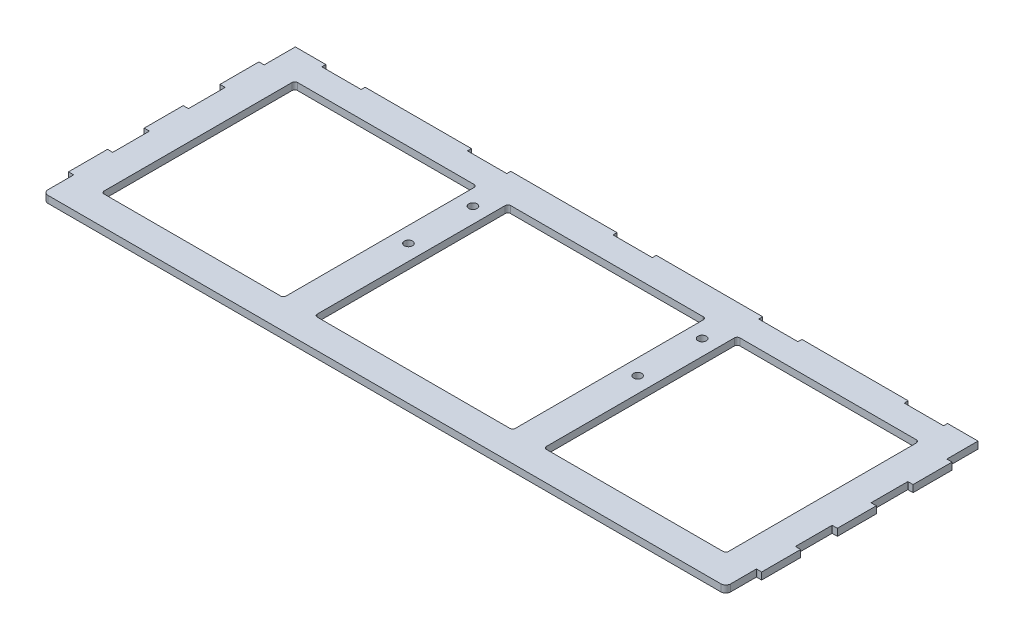
from build123d import *

# Parameters (mm, degrees)
BASE_FLANGE1_DEPTH  = 4.5
CUT_EXTRUDE1_DEPTH  = 235.407023146
SKETCH7_W           = 25.2
SKETCH7_H           = 2.55
CUT_EXTRUDE2_DEPTH  = 10
SKETCH8_W           = 3
SKETCH8_H           = 25
BOSS_EXTRUDE1_DEPTH = 4.5
CUT_EXTRUDE3_START  = -4.55
SKETCH10_W          = 0.35
SKETCH10_H          = 23.55
SKETCH10_H_2        = 20
CUT_EXTRUDE3_DEPTH  = 4.55
SKETCH11_R          = 2.65
CUT_EXTRUDE4_DEPTH  = 238.093473128


# Sheet-metal steps are written as plain solids
with BuildPart() as part:
    # Sketch1 → Base-Flange1 (new body)
    with BuildSketch(Plane(origin=(0, 0, 0), x_dir=(1, 0, 0), z_dir=(0, 1, 0))):
        with BuildLine():
            Line((-219.25, 79.3), (219.25, 79.3))
            Line((219.25, 79.3), (219.25, -79.3))
            ThreePointArc((219.25, -79.3), (218.224873734, -81.774873734), (215.75, -82.8))
            Line((215.75, -82.8), (-215.75, -82.8))
            ThreePointArc((-215.75, -82.8), (-218.224873734, -81.774873734), (-219.25, -79.3))
            Line((-219.25, -79.3), (-219.25, 79.3))
        make_face()
    extrude(amount=-BASE_FLANGE1_DEPTH)

    # Sketch6 → Cut-Extrude1 (cut, through all)
    with BuildSketch(Plane(origin=(0, 0, 0), x_dir=(1, 0, 0), z_dir=(0, 1, 0))):
        with BuildLine():
            Line((-198.45, 60.25), (-85.25, 60.25))
            ThreePointArc((-85.25, 60.25), (-84.012563133, 59.737436867), (-83.5, 58.5))
            Line((-83.5, 58.5), (-83.5, -62))
            ThreePointArc((-83.5, -62), (-84.012563133, -63.237436867), (-85.25, -63.75))
            Line((-85.25, -63.75), (-198.45, -63.75))
            ThreePointArc((-198.45, -63.75), (-199.687436867, -63.237436867), (-200.2, -62))
            Line((-200.2, -62), (-200.2, 58.5))
            ThreePointArc((-200.2, 58.5), (-199.687436867, 59.737436867), (-198.45, 60.25))
        make_face()
        with BuildLine():
            Line((200.2, 58.5), (200.2, -62))
            ThreePointArc((200.2, -62), (199.687436867, -63.237436867), (198.45, -63.75))
            Line((198.45, -63.75), (85.25, -63.75))
            ThreePointArc((85.25, -63.75), (84.012563133, -63.237436867), (83.5, -62))
            Line((83.5, -62), (83.5, 58.5))
            ThreePointArc((83.5, 58.5), (84.012563133, 59.737436867), (85.25, 60.25))
            Line((85.25, 60.25), (198.45, 60.25))
            ThreePointArc((198.45, 60.25), (199.687436867, 59.737436867), (200.2, 58.5))
        make_face()
        with BuildLine():
            Line((63.5, 58.5), (63.5, -62))
            ThreePointArc((63.5, -62), (62.987436867, -63.237436867), (61.75, -63.75))
            Line((61.75, -63.75), (-61.75, -63.75))
            ThreePointArc((-61.75, -63.75), (-62.987436867, -63.237436867), (-63.5, -62))
            Line((-63.5, -62), (-63.5, 58.5))
            ThreePointArc((-63.5, 58.5), (-62.987436867, 59.737436867), (-61.75, 60.25))
            Line((-61.75, 60.25), (61.75, 60.25))
            ThreePointArc((61.75, 60.25), (62.987436867, 59.737436867), (63.5, 58.5))
        make_face()
    extrude(amount=-CUT_EXTRUDE1_DEPTH, mode=Mode.SUBTRACT)

    # Sketch7 → Cut-Extrude2 (cut)
    with BuildSketch(Plane(origin=(0, 0, 0), x_dir=(1, 0, 0), z_dir=(0, 1, 0))):
        with Locations((-186.75, 78.025)):
            Rectangle(SKETCH7_W, SKETCH7_H)
        with Locations((-93.375, 78.025)):
            Rectangle(SKETCH7_W, SKETCH7_H)
        with Locations((0, 78.025)):
            Rectangle(SKETCH7_W, SKETCH7_H)
        with Locations((93.375, 78.025)):
            Rectangle(SKETCH7_W, SKETCH7_H)
        with Locations((186.75, 78.025)):
            Rectangle(SKETCH7_W, SKETCH7_H)
    extrude(amount=-CUT_EXTRUDE2_DEPTH, mode=Mode.SUBTRACT)

    # Sketch8 → Boss-Extrude1 (add)
    with BuildSketch(Plane(origin=(0, 0, 0), x_dir=(1, 0, 0), z_dir=(0, 1, 0))):
        with Locations((220.75, -1.75)):
            Rectangle(SKETCH8_W, SKETCH8_H)
        with Locations((220.75, 46.8)):
            Rectangle(SKETCH8_W, SKETCH8_H)
        with Locations((220.75, -50.3)):
            Rectangle(SKETCH8_W, SKETCH8_H)
    boss_extrude1 = extrude(amount=-BOSS_EXTRUDE1_DEPTH)

    # Mirror1: Boss-Extrude1 across plane
    add(boss_extrude1.mirror(Plane(origin=(0, 0, 0), x_dir=(0, 0, 1), z_dir=(1, 0, 0))))

    # Sketch10 → Cut-Extrude3 (cut)
    with BuildSketch(Plane.XZ.offset(4.5).offset(CUT_EXTRUDE3_START)):
        with Locations((-219.075, 26.025)):
            Rectangle(SKETCH10_W, SKETCH10_H)
        with Locations((-219.075, -22.525)):
            Rectangle(SKETCH10_W, SKETCH10_H)
        with Locations((-219.075, -69.3)):
            Rectangle(SKETCH10_W, SKETCH10_H_2)
        with BuildLine():
            Line((218.9, 79.3), (218.9, 62.8))
            Line((218.9, 62.8), (219.25, 62.8))
            Line((219.25, 62.8), (219.25, 79.3))
            ThreePointArc((219.25, 79.3), (218.224873734, 81.774873734), (215.75, 82.8))
            Line((215.75, 82.8), (-215.75, 82.8))
            ThreePointArc((-215.75, 82.8), (-218.224873734, 81.774873734), (-219.25, 79.3))
            Line((-219.25, 79.3), (-219.25, 62.8))
            Line((-219.25, 62.8), (-218.9, 62.8))
            Line((-218.9, 62.8), (-218.9, 79.3))
            ThreePointArc((-218.9, 79.3), (-217.977386361, 81.527386361), (-215.75, 82.45))
            Line((-215.75, 82.45), (215.75, 82.45))
            ThreePointArc((215.75, 82.45), (217.977386361, 81.527386361), (218.9, 79.3))
        make_face()
        with Locations((219.075, 26.025)):
            Rectangle(SKETCH10_W, SKETCH10_H)
        with Locations((219.075, -22.525)):
            Rectangle(SKETCH10_W, SKETCH10_H)
        with Locations((219.075, -69.3)):
            Rectangle(SKETCH10_W, SKETCH10_H_2)
    extrude(amount=CUT_EXTRUDE3_DEPTH, mode=Mode.SUBTRACT)

    # Sketch11 → Cut-Extrude4 (cut, through all)
    with BuildSketch(Plane(origin=(0, 0, 0), x_dir=(1, 0, 0), z_dir=(0, 1, 0))):
        with Locations(Location((73.5, 47.8, 0), (0, 0, 270))):
            Circle(SKETCH11_R)
        with Locations(Location((73.5, 6.434271247, 0), (0, 0, 270))):
            Circle(SKETCH11_R)
        with Locations(Location((-73.5, 6.434271247, 0), (0, 0, 270))):
            Circle(SKETCH11_R)
        with Locations(Location((-73.5, 47.8, 0), (0, 0, 270))):
            Circle(SKETCH11_R)
    extrude(amount=-CUT_EXTRUDE4_DEPTH, mode=Mode.SUBTRACT)


solid = part.part
